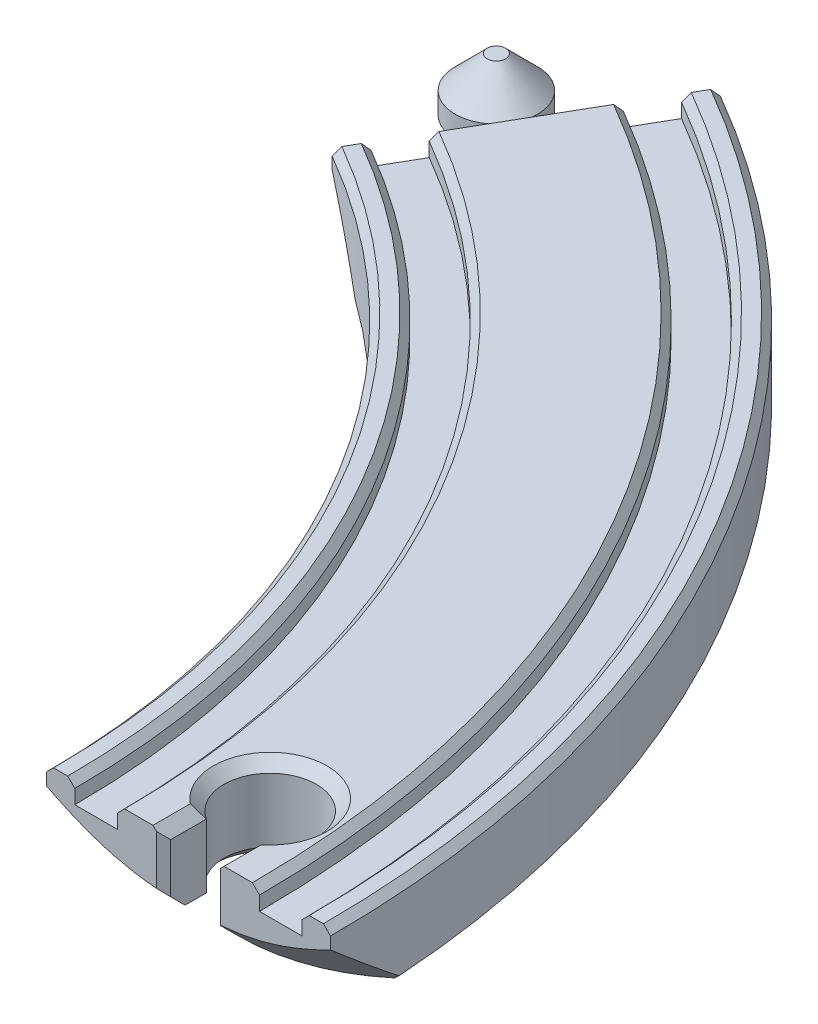
from build123d import *
from build123d.topology import SkipClean

# Parameters (mm, degrees)
REVOLVE1_ANGLE       = 60
CUT_EXTRUDE1_DEPTH   = 151.383351548
BOSS_EXTRUDE1_DEPTH  = 12
BOSS_EXTRUDE2_DEPTH  = 7.5
CUT_EXTRUDE2_DEPTH   = 4.5
CHAMFER2_SIZE        = 4.5
CHAMFER5_SIZE        = 4.5
CHAMFER5_SIZE_2      = 3
CHAMFER3_SIZE        = 1.5
CUT_REVOLVE1_ANGLE   = 90
CHAMFER4_SIZE        = 4.5
MIRROR4_COPY_1_ANGLE = 90
CHAMFER1_SIZE        = 1


# Some blends are built 0.0001 mm under size
with BuildPart() as part:
    # Sketch2 → Revolve1 (revolve)
    with BuildSketch(Plane.XY):
        Polygon((-16, 12), (-20, 12), (-20, 0), (20, 0), (20, 12), (16, 12), (16, 9), (10, 9), (10, 12), (-10, 12), (-10, 9), (-16, 9), align=None)
    revolve(axis=Axis((-129.903810568, 0, 0), (0, 1, 0)), revolution_arc=REVOLVE1_ANGLE)

    # Sketch3 → Cut-Extrude1 (cut, through all)
    with BuildSketch(Plane(origin=(0, 12, 0), x_dir=(1, 0, 0), z_dir=(0, 1, 0))):
        with BuildLine():
            ThreePointArc((6.5, 11.5), (-3.122498999, 17.200877125), (-3.5, 6.022774425))
            Line((-3.5, 6.022774425), (-3.5, 11.5))
            Line((-3.5, 11.5), (3.5, 11.5))
            Line((3.5, 11.5), (3.5, 6.022774425))
            ThreePointArc((3.5, 6.022774425), (5.700877125, 8.377501001), (6.5, 11.5))
        make_face()
        with BuildLine():
            Line((-3.5, 11.5), (-3.5, 6.022774425))
            ThreePointArc((-3.5, 6.022774425), (0, 5), (3.5, 6.022774425))
            Line((3.5, 6.022774425), (3.5, 11.5))
            Line((3.5, 11.5), (-3.5, 11.5))
        make_face()
        with BuildLine():
            Line((-3.5, 6.022774425), (-3.5, 0))
            Line((-3.5, 0), (3.5, 0))
            Line((3.5, 0), (3.5, 6.022774425))
            ThreePointArc((3.5, 6.022774425), (0, 5), (-3.5, 6.022774425))
        make_face()
    extrude(amount=-CUT_EXTRUDE1_DEPTH, mode=Mode.SUBTRACT)



with BuildPart() as body_2:
    # Sketch4 → Boss-Extrude1 (new body)
    with BuildSketch(Plane(origin=(0, 12, 0), x_dir=(1, 0, 0), z_dir=(0, 1, 0))):
        with BuildLine():
            ThreePointArc((-71.628813948, 113.468163669), (-69.888250085, 115.35), (-69.128813948, 117.798290688))
            Line((-69.128813948, 117.798290688), (-73.661197427, 120.415063509))
            Line((-73.661197427, 120.415063509), (-76.161197427, 116.084936491))
            Line((-76.161197427, 116.084936491), (-71.628813948, 113.468163669))
        make_face()
        with BuildLine():
            Line((-73.661197427, 120.415063509), (-69.128813948, 117.798290688))
            ThreePointArc((-69.128813948, 117.798290688), (-69.115603231, 118.023973649), (-69.111197427, 118.25))
            ThreePointArc((-69.111197427, 118.25), (-80.043342407, 120.952052537), (-71.628813948, 113.468163669))
            Line((-71.628813948, 113.468163669), (-76.161197427, 116.084936491))
            Line((-76.161197427, 116.084936491), (-73.661197427, 120.415063509))
        make_face()
    extrude(amount=-BOSS_EXTRUDE1_DEPTH)


with BuildPart() as part_1:
    add(part.part)

    add(body_2.part)  # Boss-Extrude2 merges body 2
    # Sketch4<3> → Boss-Extrude2 (add)
    with BuildSketch(Plane(origin=(0, 12, 0), x_dir=(1, 0, 0), z_dir=(0, 1, 0))):
        with BuildLine():
            Line((-66.201905284, 110.334936491), (-63.701905284, 114.665063509))
            Line((-63.701905284, 114.665063509), (-69.128813948, 117.798290688))
            ThreePointArc((-69.128813948, 117.798290688), (-69.888250085, 115.35), (-71.628813948, 113.468163669))
            Line((-71.628813948, 113.468163669), (-66.201905284, 110.334936491))
        make_face()
    extrude(amount=-BOSS_EXTRUDE2_DEPTH)

    # Sketch4<5> → Cut-Extrude2 (cut)
    with SkipClean():  # the faces are left unmerged after this step: merging them gives an invalid solid
        with BuildSketch(Plane(origin=(0, 12, 0), x_dir=(1, 0, 0), z_dir=(0, 1, 0))):
            with BuildLine():
                Line((-66.201905284, 110.334936491), (-63.701905284, 114.665063509))
                Line((-63.701905284, 114.665063509), (-69.128813948, 117.798290688))
                ThreePointArc((-69.128813948, 117.798290688), (-69.888250085, 115.35), (-71.628813948, 113.468163669))
                Line((-71.628813948, 113.468163669), (-66.201905284, 110.334936491))
            make_face()
        extrude(amount=-CUT_EXTRUDE2_DEPTH, mode=Mode.SUBTRACT)

    # Chamfer2
    chamfer2_edges = [part_1.edges().sort_by_distance(p)[0] for p in [
        (-79.934144769, 12, -121.15),
    ]]
    chamfer(chamfer2_edges, length=CHAMFER2_SIZE - 0.0001)  # a hair under: the kernel refuses the full size

    # Chamfer5
    # the kernel refuses this chamfer: 4.5, 3 mm, written as the material it takes off along each edge
    with BuildSketch(Plane(origin=(-74.911197427, 0, -118.25), x_dir=(0.5659281860209275, 1.3089718800099638e-15, 0.8244545398425934), z_dir=(-0.8244545398425934, -1.906934193520804e-15, 0.5659281860209275))) as chamfer5_piece_1:
        Polygon((5.8, CHAMFER5_SIZE), (5.8 - CHAMFER5_SIZE_2, 0), (5.8, 0), align=None)
    revolve(axis=Axis((-74.911197427, 0, -118.25), (0, 1, 0)), mode=Mode.SUBTRACT)

    # Chamfer3
    chamfer3_edges = [part_1.edges().sort_by_distance(p)[0] for p in [
        (0, 0, -18),
        (3.5, 0, -3.011387212),
        (-3.5, 12, -3.011387212),
        (-3.5, 0, -3.011387212),
        (0, 12, -18),
        (3.5, 12, -3.011387212),
    ]]
    chamfer(chamfer3_edges, length=CHAMFER3_SIZE)

    # Sketch17 → Cut-Revolve1 (revolve, cut)
    with BuildSketch(Plane(origin=(31.225952642, 0, -54.084936491), x_dir=(0.8660254037844438, 0, 0.49999999999999123), z_dir=(-0.49999999999999123, -1.1564823173178522e-15, 0.8660254037844438))):
        Polygon((-118.766454357, 10.766454357), (-118.766454357, 0), (-108, 0), align=None)
    cut_revolve1 = revolve(axis=Axis((-40.654155872, -1.265151723, -95.584936491), (0, 1, 0)), revolution_arc=CUT_REVOLVE1_ANGLE, mode=Mode.SUBTRACT)

    # Mirror1: Cut-Revolve1 across plane
    add(cut_revolve1.mirror(Plane(origin=(32.475952642, 0, -56.25), x_dir=(0.8660254037844437, 2.0030861316495613e-15, 0.4999999999999914), z_dir=(-0.49999999999999156, -1.1564823173178542e-15, 0.8660254037844436))), mode=Mode.SUBTRACT)

    # Chamfer4
    chamfer4_edges = [part_1.edges().sort_by_distance(p)[0] for p in [
        (-64.951905284, 0, -112.5),
    ]]
    chamfer(chamfer4_edges, length=CHAMFER4_SIZE - 0.0001)  # a hair under: the kernel refuses the full size

    # Mirror4: Cut-Revolve1 across plane
    add(cut_revolve1.mirror(Plane(origin=(-32.475952642, 0, -56.25), x_dir=(-0.8660254037844385, -2.0030861316495455e-15, 0.5000000000000006), z_dir=(-0.5000000000000009, -1.1564823173178735e-15, -0.8660254037844383))), mode=Mode.SUBTRACT)

    # Mirror4 copy 1 sketch → Mirror4 copy 1 (revolve, cut)
    with BuildSketch(Plane(origin=(2.5, 0, -112.5), x_dir=(0, 0, -1), z_dir=(1, 0, 0))):
        Polygon((-118.766454357, 10.766454357), (-118.766454357, 0), (-108, 0), align=None)
    revolve(axis=Axis((2.5, -1.265151723, -29.5), (0, 1, 0)), revolution_arc=MIRROR4_COPY_1_ANGLE, mode=Mode.SUBTRACT)

    # Chamfer1
    chamfer1_edges = [part_1.edges().sort_by_distance(p)[0] for p in [
        (-34.724318643, 0, -54.951905284),
        (-0.083302492, 0, -74.951905284),
        (-3.5, 7.508472143, 0),
        (3.5, 7.508472143, 0),
        (-31.260217028, 12, -56.951905284),
        (-26.064064606, 12, -59.951905284),
        (-8.74355653, 12, -69.951905284),
        (-3.547404107, 12, -72.951905284),
        (-0.083302492, 12, -74.951905284),
        (-34.724318643, 12, -54.951905284),
    ]]
    chamfer(chamfer1_edges, length=CHAMFER1_SIZE)


solid = part_1.part
